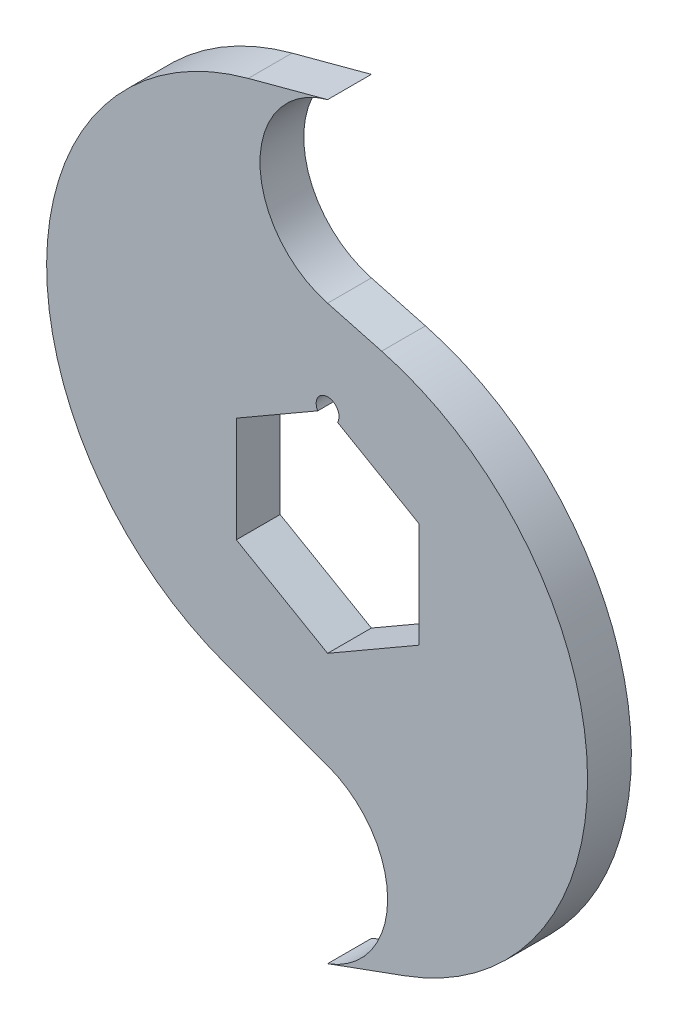
from build123d import *

# Parameters (mm, degrees)
BOSS_EXTRUDE1_DEPTH = 3.048


with BuildPart() as part:
    # Sketch1 → Boss-Extrude1 (new, symmetric)
    with BuildSketch(Plane.XY):
        with BuildLine():
            ThreePointArc((0, 27.535484012), (-9.412998127, 39.802742006), (0, 52.07))
            Line((0, 52.07), (-11.040532194, 49.111698314))
            ThreePointArc((-11.040532194, 49.111698314), (-39.066320922, 14.192289272), (-14.190605813, -23.03684931))
            Line((-14.190605813, -23.03684931), (0, -28.201807432))
            ThreePointArc((0, -28.201807432), (8.35634418, -40.135903716), (0, -52.07))
            Line((0, -52.07), (10.740686656, -48.160709762))
            ThreePointArc((10.740686656, -48.160709762), (36.144496882, -10.141220984), (7.52373904, 25.519504212))
            Line((7.52373904, 25.519504212), (0, 27.535484012))
        make_face()
        with BuildLine():
            Line((-12.7, 7.332348419), (-1.374815329, 13.870946837))
            ThreePointArc((-1.374815329, 13.870946837), (-0.410875234, 16.198104087), (1.5875, 14.664696837))
            ThreePointArc((1.5875, 14.664696837), (1.533407249, 14.253821603), (1.374815329, 13.870946837))
            Line((1.374815329, 13.870946837), (12.7, 7.332348419))
            Line((12.7, 7.332348419), (12.7, -7.332348419))
            Line((12.7, -7.332348419), (0, -14.664696837))
            Line((0, -14.664696837), (-12.7, -7.332348419))
            Line((-12.7, -7.332348419), (-12.7, 7.332348419))
        make_face(mode=Mode.SUBTRACT)
    extrude(amount=BOSS_EXTRUDE1_DEPTH, both=True)


solid = part.part
